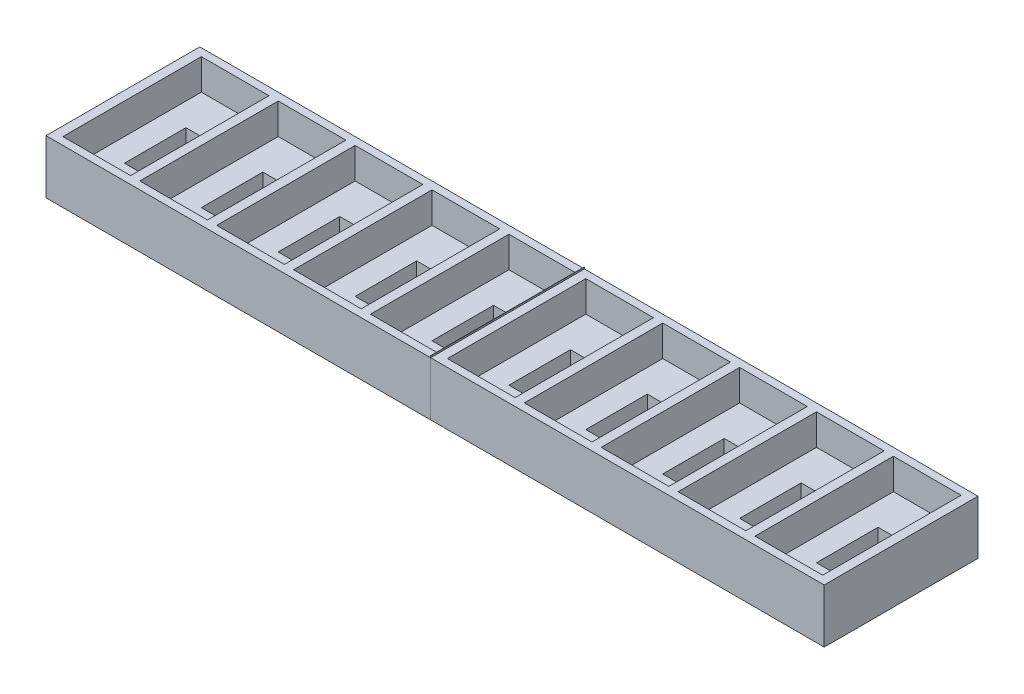
from build123d import *

# Parameters (mm, degrees)
SKETCH1_W           = 253
SKETCH1_H           = 50
BOSS_EXTRUDE1_DEPTH = 17.5
SKETCH2_W           = 22
SKETCH2_H           = 45
CUT_EXTRUDE1_DEPTH  = 10
SKETCH3_W           = 14.5
SKETCH3_H           = 20
CUT_EXTRUDE2_DEPTH  = 17.5
LPATTERN1_COUNT     = 10
LPATTERN1_PITCH     = 25
SKETCH4_W           = 50
SKETCH4_H           = 18
BOSS_EXTRUDE2_DEPTH = 0.05


with BuildPart() as part:
    # Sketch1 → Boss-Extrude1 (new body)
    with BuildSketch(Plane(origin=(0, 0, 0), x_dir=(1, 0, 0), z_dir=(0, 1, 0))):
        with Locations((126.5, -25)):
            Rectangle(SKETCH1_W, SKETCH1_H)
    extrude(amount=BOSS_EXTRUDE1_DEPTH)

    # Sketch2 → Cut-Extrude1 (cut)
    with BuildSketch(Plane(origin=(0, 17.5, 0), x_dir=(1, 0, 0), z_dir=(0, 1, 0))):
        with Locations((14, -25)):
            Rectangle(SKETCH2_W, SKETCH2_H)
    cut_extrude1 = extrude(amount=-CUT_EXTRUDE1_DEPTH, mode=Mode.SUBTRACT)

    # Sketch3 → Cut-Extrude2 (cut)
    with BuildSketch(Plane(origin=(0, 17.5, 0), x_dir=(1, 0, 0), z_dir=(0, 1, 0))):
        with Locations((17.75, -25)):
            Rectangle(SKETCH3_W, SKETCH3_H)
    cut_extrude2 = extrude(amount=-CUT_EXTRUDE2_DEPTH, mode=Mode.SUBTRACT)

    # LPattern1: Cut-Extrude1, Cut-Extrude2 ×10
    with Locations(*[(i * LPATTERN1_PITCH, 0, 0) for i in range(1, LPATTERN1_COUNT)]):
        add(cut_extrude1, mode=Mode.SUBTRACT)
        add(cut_extrude2, mode=Mode.SUBTRACT)

    # Sketch4 → Boss-Extrude2 (add, symmetric)
    with BuildSketch(Plane.ZY.offset(-125)):
        with Locations((25, 9)):
            Rectangle(SKETCH4_W, SKETCH4_H)
    extrude(amount=BOSS_EXTRUDE2_DEPTH, both=True)


with BuildPart() as body_2:
    # Split1: the piece on the far side of the plane
    add(part.part)
    split(bisect_by=Plane(origin=(125.05, 0, 0), x_dir=(0, 0, -1), z_dir=(-1, 0, 0)), keep=Keep.BOTTOM)


with BuildPart() as part_1:
    add(part.part)

    # Split1
    split(bisect_by=Plane(origin=(125.05, 0, 0), x_dir=(0, 0, -1), z_dir=(-1, 0, 0)), keep=Keep.TOP)


solid = Compound([body_2.part, part_1.part])
